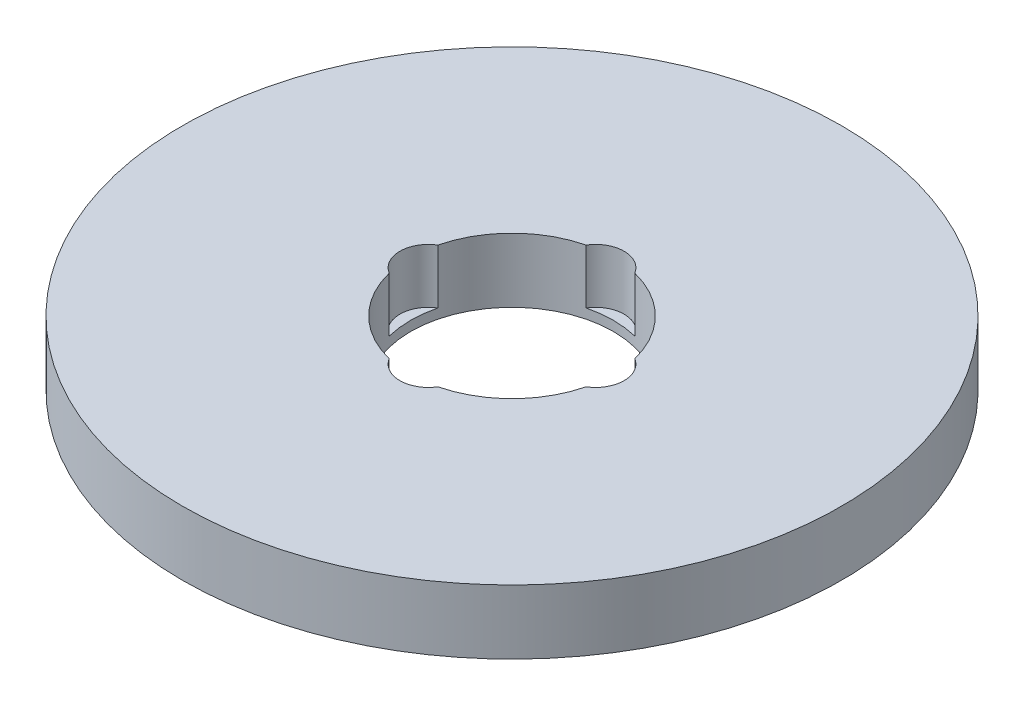
from build123d import *

# Parameters (mm, degrees)
SKETCH1_R           = 97.5
BOSS_EXTRUDE1_DEPTH = 19
SKETCH2_R           = 30
CUT_EXTRUDE1_DEPTH  = 140.188720807
SKETCH3_R           = 8.441038437
CUT_EXTRUDE2_DEPTH  = 16.127126092
CIRPATTERN1_COUNT   = 4


with BuildPart() as part:
    # Sketch1 → Boss-Extrude1 (new body)
    with BuildSketch(Plane(origin=(0, 0, 0), x_dir=(1, 0, 0), z_dir=(0, 1, 0))):
        Circle(SKETCH1_R)
    extrude(amount=BOSS_EXTRUDE1_DEPTH)

    # Sketch2 → Cut-Extrude1 (cut, through all)
    with BuildSketch(Plane(origin=(0, 0, 0), x_dir=(1, 0, 0), z_dir=(0, 1, 0))):
        Circle(SKETCH2_R)
    extrude(amount=CUT_EXTRUDE1_DEPTH, mode=Mode.SUBTRACT)

    # Sketch3 → Cut-Extrude2 (cut)
    with BuildSketch(Plane(origin=(0, 19, 0), x_dir=(1, 0, 0), z_dir=(0, 1, 0))):
        with Locations((-24.723842975, 0)):
            Circle(SKETCH3_R)
    cut_extrude2 = extrude(amount=-CUT_EXTRUDE2_DEPTH, mode=Mode.SUBTRACT)

    # CirPattern1: Cut-Extrude2 ×4 about axis
    cirpattern1_axis = Axis((0, 0, 0), (0, 1, 0))
    for i in range(1, CIRPATTERN1_COUNT):
        add(cut_extrude2.rotate(cirpattern1_axis, i * 360 / CIRPATTERN1_COUNT), mode=Mode.SUBTRACT)


solid = part.part
